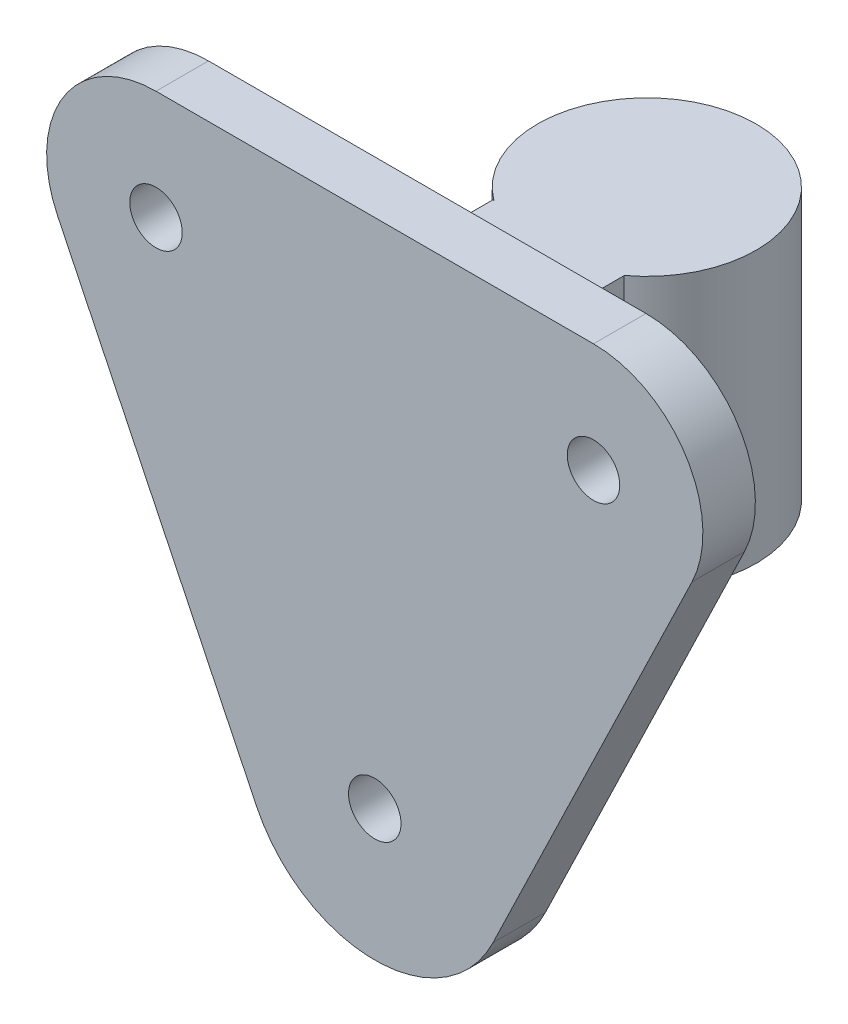
from build123d import *

# Parameters (mm, degrees)
Y_KSEKLIK_EKSTR_ZYON1_OUTLINE_R = 6
Y_KSEKLIK_EKSTR_ZYON1_DEPTH     = 12
Y_KSEKLIK_EKSTR_ZYON6_DEPTH     = 62


# Read off the part's stored shape, not the designer's step: Yükseklik-Ekstrüzyon1
with BuildPart() as part:
    # Yükseklik-Ekstrüzyon1 outline → Yükseklik-Ekstrüzyon1 (new body)
    with BuildSketch(Plane.XY):
        with BuildLine():
            ThreePointArc((-6.071419214, 35.304785694), (-7.405582554, 59.467641529), (-28.582022208, 71.180113408))
            Line((-28.582022208, 71.180113408), (-128.582022208, 71.180113408))
            ThreePointArc((-128.582022208, 71.180113408), (-149.758461862, 59.467641529), (-151.092625201, 35.304785694))
            Line((-151.092625201, 35.304785694), (-105.594745799, -58.870279849))
            ThreePointArc((-105.594745799, -58.870279849), (-78.582022207, -75.819886592), (-51.569298616, -58.870279849))
            Line((-51.569298616, -58.870279849), (-6.071419214, 35.304785694))
        make_face()
        with Locations((-78.582022208, -45.819886592)):
            Circle(Y_KSEKLIK_EKSTR_ZYON1_OUTLINE_R, mode=Mode.SUBTRACT)
        with Locations((-128.582022208, 46.180113408)):
            Circle(Y_KSEKLIK_EKSTR_ZYON1_OUTLINE_R, mode=Mode.SUBTRACT)
        with Locations((-28.582022208, 46.180113408)):
            Circle(Y_KSEKLIK_EKSTR_ZYON1_OUTLINE_R, mode=Mode.SUBTRACT)
    extrude(amount=Y_KSEKLIK_EKSTR_ZYON1_DEPTH)

    # Çizim6 → Yükseklik-Ekstrüzyon6 (add)
    with BuildSketch(Plane(origin=(0, 46.180113408, 0), x_dir=(1, 0, 0), z_dir=(0, 1, 0))):
        with BuildLine():
            Line((-93.582022208, 0), (-63.582022208, 0))
            Line((-63.582022208, 0), (-63.582022208, 30))
            Line((-63.582022208, 30), (-63.662550873, 30))
            ThreePointArc((-63.662550873, 30), (-78.505910332, 75.116527532), (-93.349269791, 30))
            Line((-93.349269791, 30), (-93.582022208, 30))
            Line((-93.582022208, 30), (-93.582022208, 0))
        make_face()
    extrude(amount=-Y_KSEKLIK_EKSTR_ZYON6_DEPTH)


solid = part.part
